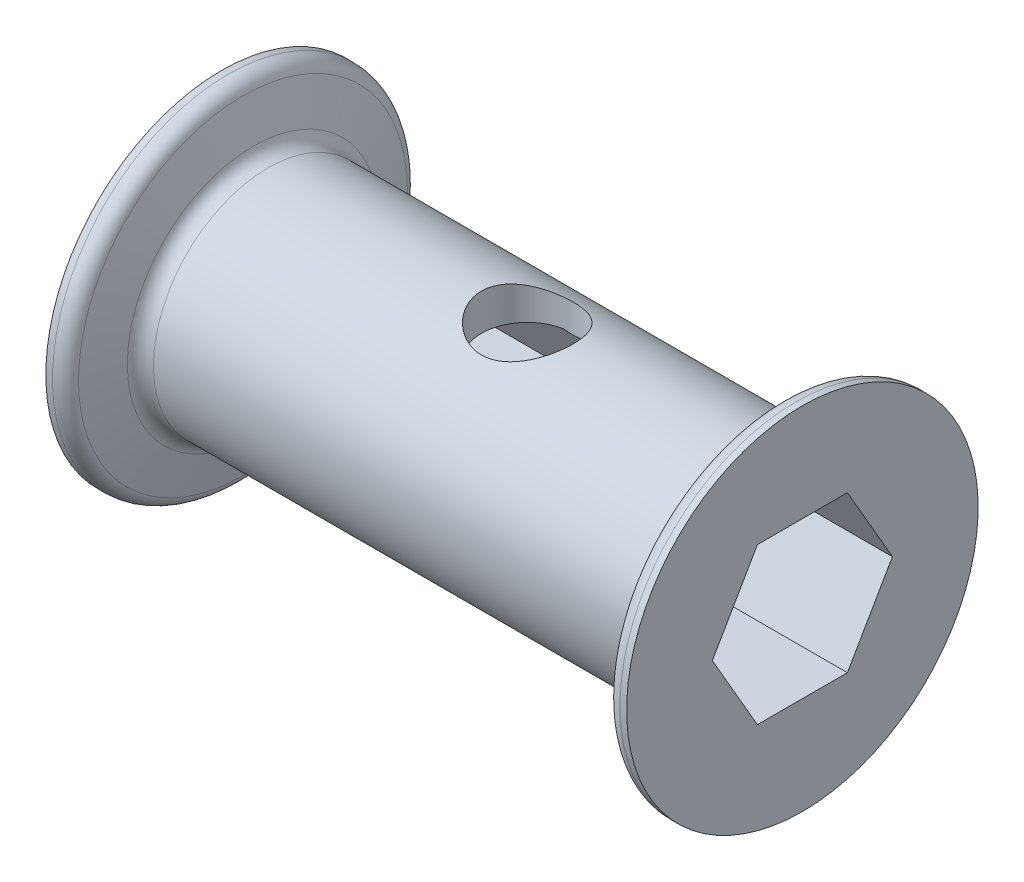
from build123d import *

# Parameters (mm, degrees)
CUT_EXTRUDE1_DEPTH = 53.494186821
FILLET1_R          = 1.27


with BuildPart() as part:
    # Sketch1 → Revolve1 (revolve)
    with BuildSketch(Plane.XY):
        Polygon((0, 0), (48.26, 0), (48.26, 14.605), (46.736, 14.605), (45.374818102, 9.525), (2.885181898, 9.525), (1.524, 14.605), (0, 14.605), align=None)
    revolve(axis=Axis((48.26, 0, 0), (-1, 0, 0)))

    # Sketch2 → Cut-Extrude1 (cut, through all)
    with BuildSketch(Plane.ZY):
        Polygon((7.478995387, 0), (3.739497694, 6.477), (-3.739497694, 6.477), (-7.478995387, 0), (-3.739497694, -6.477), (3.739497694, -6.477), align=None)
    extrude(amount=-CUT_EXTRUDE1_DEPTH, mode=Mode.SUBTRACT)

    # Fillet1
    fillet1_edges = [part.edges().sort_by_distance(p)[0] for p in [
        (2.885181898, -9.525, 0),
        (1.524, -14.605, 0),
        (46.736, -14.605, 0),
        (45.374818102, -9.525, 0),
    ]]
    fillet(fillet1_edges, radius=FILLET1_R)

    # Sketch3 → Cut-Revolve1 (revolve, cut)
    with BuildSketch(Plane.XY):
        Polygon((27.305, -14.605), (25.4, -14.605), (25.4, 14.605), (29.21, 14.605), (29.21, -0.025313637), (27.305, -0.025313637), align=None)
    revolve(axis=Axis((25.4, 14.605, 0), (0, 1, 0)), mode=Mode.SUBTRACT)


solid = part.part
